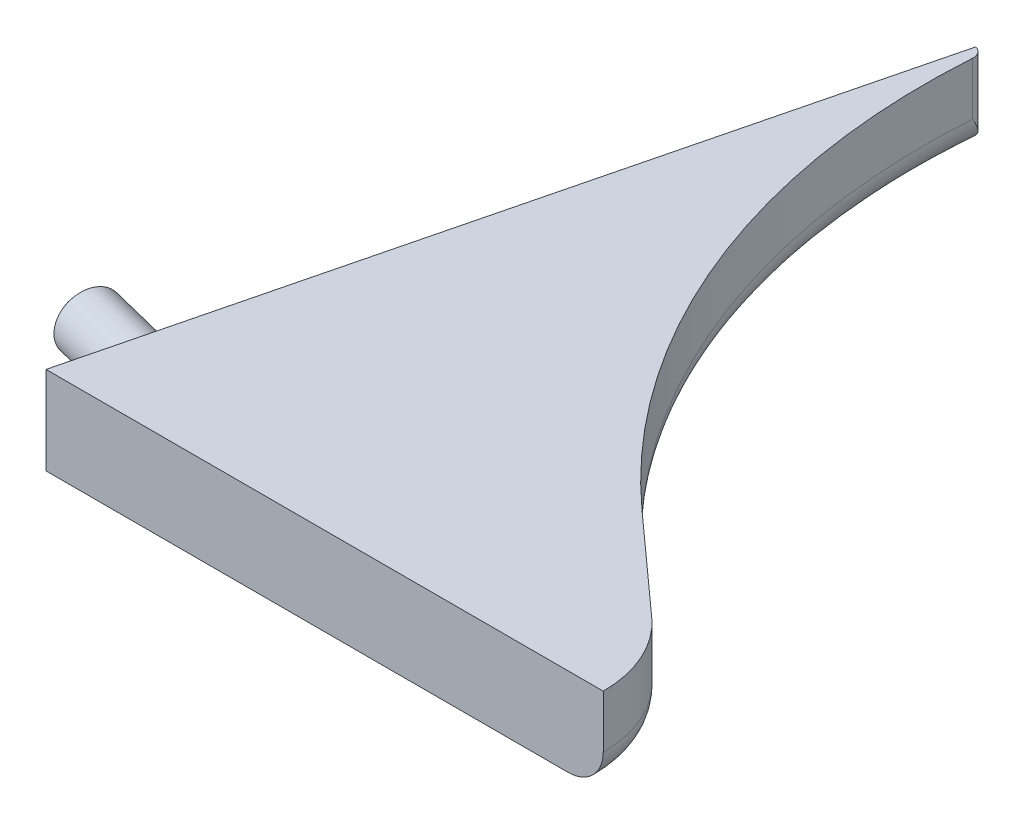
from build123d import *

# Parameters (mm, degrees)
BOSS_EXTRUDE1_DEPTH = 2.5
SKETCH2_R           = 1.625
BOSS_EXTRUDE2_DEPTH = 5.5
CHAMFER1_SIZE       = 0.5
FILLET2_R           = 2


with BuildPart() as part:
    # Sketch1 → Boss-Extrude1 (new, symmetric)
    with BuildSketch(Plane(origin=(0, 0, 0), x_dir=(1, 0, 0), z_dir=(0, 1, 0))):
        with BuildLine():
            Line((0, 0), (31.692840332, 0))
            ThreePointArc((31.692840332, 0), (31.114494888, 2.721592177), (29.479411171, 4.972824878))
            Line((29.479411171, 4.972824878), (23.85490024, 10.039260498))
            ThreePointArc((23.85490024, 10.039260498), (13.799067859, 24.384002459), (11.023460035, 41.68103654))
            ThreePointArc((11.023460035, 41.68103654), (10.905516567, 42.089144278), (10.553169202, 42.326449823))
            Line((10.553169202, 42.326449823), (0, 0))
        make_face()
    extrude(amount=BOSS_EXTRUDE1_DEPTH, both=True)

    # Sketch2 → Boss-Extrude2 (add)
    with BuildSketch(Plane(origin=(0, 0, 0), x_dir=(-0.24192189559966498, 0, 0.9702957262759973), z_dir=(-0.9702957262759971, 0, -0.24192189559966495))):
        with Locations(Location((-5, 0, 0), (0, 0, 180))):
            Circle(SKETCH2_R)
    extrude(amount=BOSS_EXTRUDE2_DEPTH)

    # Chamfer1
    chamfer1_edges = [part.edges().sort_by_distance(p)[0] for p in [
        (-4.520140097, 0, -4.605318502),
    ]]
    chamfer(chamfer1_edges, length=CHAMFER1_SIZE)

    # Sketch3 → Cut-Revolve4 (revolve, cut)
    with BuildSketch(Plane(origin=(0, 0, 0), x_dir=(1, 0, 0), z_dir=(0, 1, 0))):
        with BuildLine():
            Line((0.816486398, 3.274748076), (0.707621545, 2.838114999))
            ThreePointArc((0.707621545, 2.838114999), (0.73826383, 2.905034263), (0.791037406, 2.956338134))
            Line((0.791037406, 2.956338134), (0.863180576, 3.004248082))
            ThreePointArc((0.863180576, 3.004248082), (0.928011981, 3.154719604), (0.816486398, 3.274748076))
        make_face()
    revolve(axis=Axis((-4.382099311, 0, -6.245648216), (0.9702957262759973, 0, 0.2419218955996649)), mode=Mode.SUBTRACT)

    # Fillet2
    # the kernel refuses this fillet: 2 mm, written as the material it takes off along each edge
    with BuildSketch(Plane(origin=(25, -2.5, 0), x_dir=(0.7336270149477808, 0, 0.6795523548180881), z_dir=(-0.6795523548180881, 0, 0.7336270149477808))) as fillet2_piece_1:
        with BuildLine():
            CenterArc((6.692840332 - FILLET2_R, FILLET2_R), FILLET2_R, 270, 90)
            Line((6.692840332, FILLET2_R), (6.692840332, 0))
            Line((6.692840332, 0), (6.692840332 - FILLET2_R, 0))
        make_face()
    revolve(axis=Axis((25, -2.5, 0), (0, 1, 0)), revolution_arc=90.796842199, mode=Mode.SUBTRACT)
    with BuildSketch(Plane(origin=(29.479411171, -2.5, -4.972824878), x_dir=(-0.6692840332038654, 0, 0.7430066506420836), z_dir=(-0.7430066506420837, 0, -0.6692840332038654))) as fillet2_piece_2:
        with BuildLine():
            CenterArc((FILLET2_R, FILLET2_R), FILLET2_R, 180, 90)
            Line((0, FILLET2_R), (0, 0))
            Line((0, 0), (FILLET2_R, 0))
        make_face()
    extrude(amount=7.569933494, mode=Mode.SUBTRACT)
    with BuildSketch(Plane(origin=(50, -2.5, -39.064281325), x_dir=(-0.6692840332038644, 0, 0.7430066506420845), z_dir=(0.7430066506420845, 0, 0.6692840332038644))) as fillet2_piece_3:
        with BuildLine():
            CenterArc((39.064281325 + FILLET2_R, -FILLET2_R), FILLET2_R, 90, 90)
            Line((39.064281325, -FILLET2_R), (39.064281325, 0))
            Line((39.064281325, 0), (39.064281325 + FILLET2_R, 0))
        make_face()
    revolve(axis=Axis((50, -2.5, -39.064281325), (0, -1, 0)), revolution_arc=59.163556195, mode=Mode.SUBTRACT)


solid = part.part
